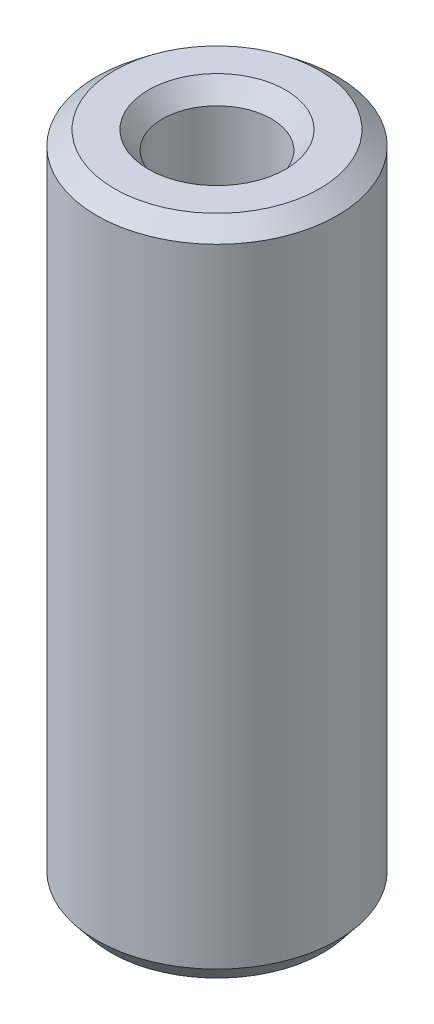
from build123d import *
from OCP.BRepFilletAPI import BRepFilletAPI_MakeChamfer

# Parameters (mm, degrees)
SKETCH1_R           = 17.5
BOSS_EXTRUDE1_DEPTH = 95.935514655
SKETCH2_R           = 7.90929518
CUT_EXTRUDE1_DEPTH  = 100.076349207
CHAMFER1_SIZE       = 2.073734413
CHAMFER1_SIZE2      = 2.593758585


with BuildPart() as part:
    # Sketch1 → Boss-Extrude1 (new body)
    with BuildSketch(Plane(origin=(0, 0, 0), x_dir=(1, 0, 0), z_dir=(0, 1, 0))):
        Circle(SKETCH1_R)
    extrude(amount=BOSS_EXTRUDE1_DEPTH)

    # Sketch2 → Cut-Extrude1 (cut, through all)
    with BuildSketch(Plane(origin=(0, 0, 0), x_dir=(1, 0, 0), z_dir=(0, 1, 0))):
        Circle(SKETCH2_R)
    extrude(amount=CUT_EXTRUDE1_DEPTH, mode=Mode.SUBTRACT)

    # Chamfer1: one chamfer whose edges measure the first distance from different faces: ONE call of the kernel's chamfer builder (chamfer() names one face for all edges)
    chamfer1_edges_1 = [part.edges().sort_by_distance(p)[0] for p in [
        (-7.90929518, 95.935514655, 0),
    ]]
    chamfer1_side_1 = [part.faces().sort_by_distance(p)[0] for p in [
        (-17.005025253, 95.935514655, 0),
    ]]
    chamfer1_edges_2 = [part.edges().sort_by_distance(p)[0] for p in [
        (-7.90929518, 0, 0),
    ]]
    chamfer1_side_2 = [part.faces().sort_by_distance(p)[0] for p in [
        (-7.90929518, 47.967757328, 0),
    ]]
    chamfer1_edges_3 = [part.edges().sort_by_distance(p)[0] for p in [
        (-17.5, 0, 0),
    ]]
    chamfer1_side_3 = [part.faces().sort_by_distance(p)[0] for p in [
        (-17.005025253, 0, 0),
    ]]
    chamfer1_edges_4 = [part.edges().sort_by_distance(p)[0] for p in [
        (-17.5, 95.935514655, 0),
    ]]
    chamfer1_side_4 = [part.faces().sort_by_distance(p)[0] for p in [
        (-17.5, 47.967757328, 0),
    ]]
    chamfer1 = BRepFilletAPI_MakeChamfer(part.part.solid().wrapped)
    for e in chamfer1_edges_1:
        chamfer1.Add(CHAMFER1_SIZE, CHAMFER1_SIZE2, e.wrapped, chamfer1_side_1[0].wrapped)  # the first distance lies on this face
    for e in chamfer1_edges_2:
        chamfer1.Add(CHAMFER1_SIZE, CHAMFER1_SIZE2, e.wrapped, chamfer1_side_2[0].wrapped)  # the first distance lies on this face
    for e in chamfer1_edges_3:
        chamfer1.Add(CHAMFER1_SIZE, CHAMFER1_SIZE2, e.wrapped, chamfer1_side_3[0].wrapped)  # the first distance lies on this face
    for e in chamfer1_edges_4:
        chamfer1.Add(CHAMFER1_SIZE, CHAMFER1_SIZE2, e.wrapped, chamfer1_side_4[0].wrapped)  # the first distance lies on this face
    add(Compound.cast(chamfer1.Shape()), mode=Mode.REPLACE)


solid = part.part
